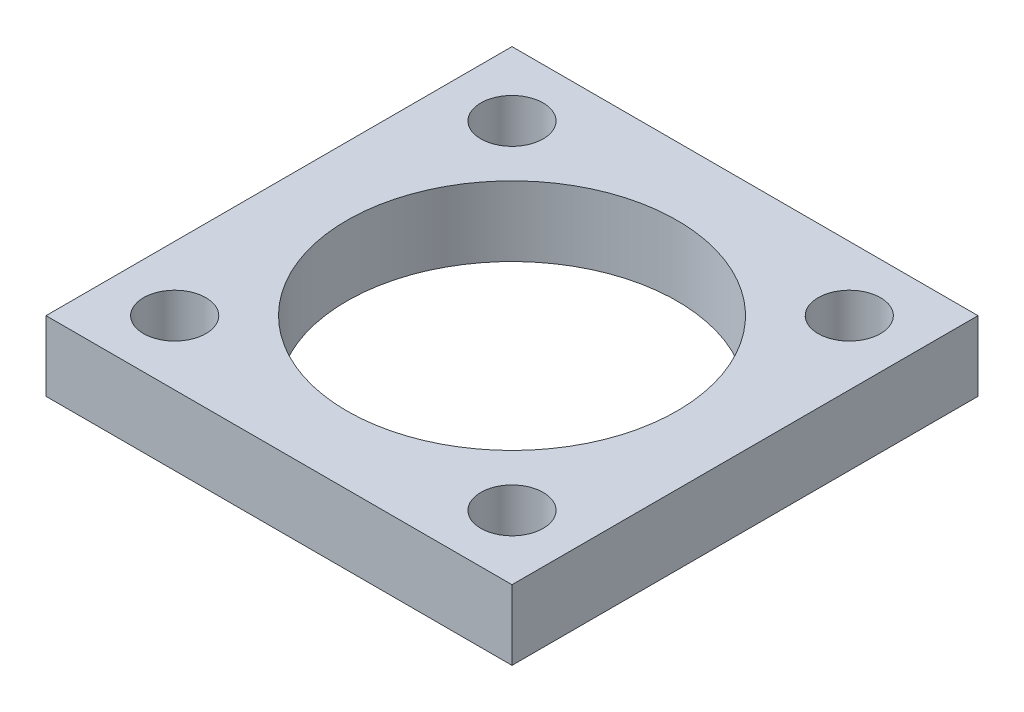
from build123d import *

# Parameters (mm, degrees)
SKETCH2_W            = 25.4
SKETCH2_H            = 25.4
BOSS_EXTRUDE1_DEPTH  = 3.81
SKETCH4_R            = 9
CUT_EXTRUDE1_DEPTH   = 19.360177014
M3_CLEARANCE_HOLE2_D = 3.4


with BuildPart() as part:
    # Sketch2 → Boss-Extrude1 (new body)
    with BuildSketch(Plane(origin=(0, 0, 0), x_dir=(1, 0, 0), z_dir=(0, 1, 0))):
        Rectangle(SKETCH2_W, SKETCH2_H)
    extrude(amount=BOSS_EXTRUDE1_DEPTH)

    # Sketch4 → Cut-Extrude1 (cut, through all)
    with BuildSketch(Plane(origin=(0, 3.81, 0), x_dir=(1, 0, 0), z_dir=(0, 1, 0))):
        Circle(SKETCH4_R)
    extrude(amount=-CUT_EXTRUDE1_DEPTH, mode=Mode.SUBTRACT)

    # M3 Clearance Hole2 (through all)
    with Locations(Plane(origin=(-9.192388155, 3.81, -9.192388155), x_dir=(0, 0, 1), z_dir=(0, 1, 0))):
        with Locations((0, 0), (18.38477631, 18.38477631), (0, 18.38477631), (18.38477631, 0)):
            Hole(M3_CLEARANCE_HOLE2_D / 2)


solid = part.part
